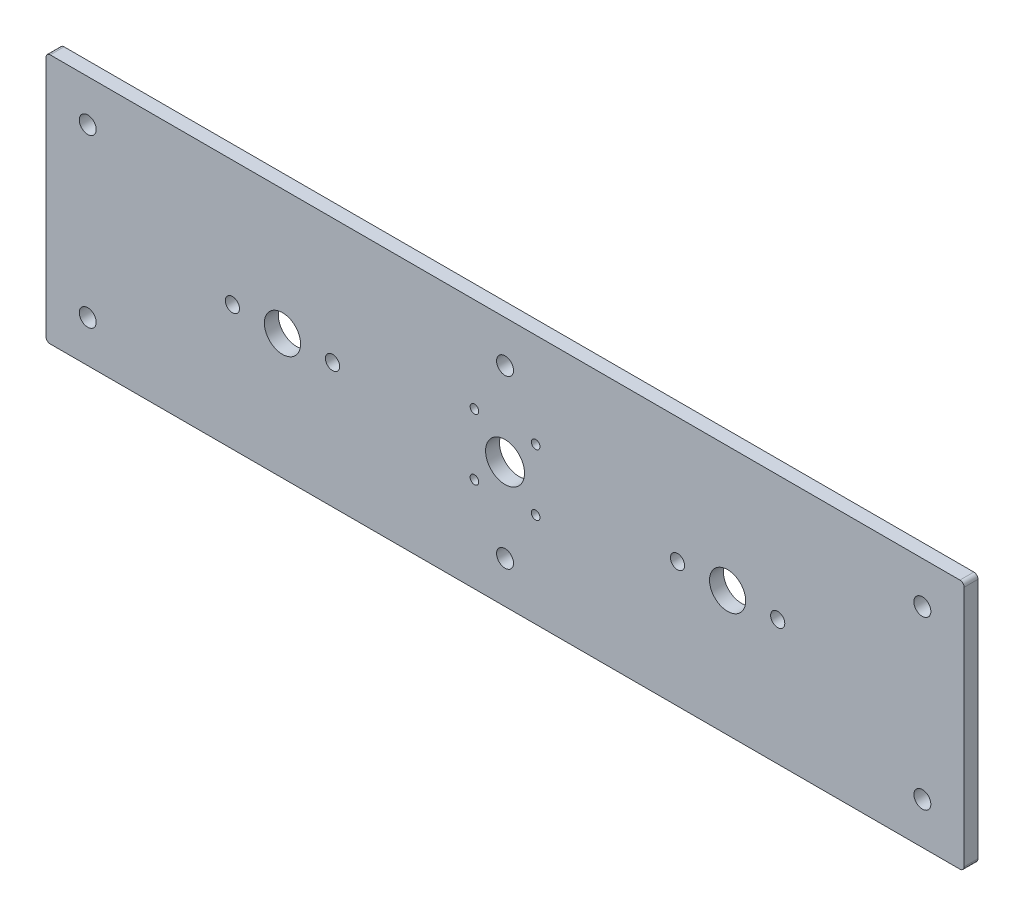
from build123d import *

# Parameters (mm, degrees)
SKETCH1_W           = 330
SKETCH1_H           = 90
BOSS_EXTRUDE1_DEPTH = 2.5
SKETCH2_R           = 3.05
CUT_EXTRUDE1_DEPTH  = 172.099386323
SKETCH3_R           = 6.5
SKETCH3_R_2         = 2.55
CUT_EXTRUDE2_DEPTH  = 172.099386323
SKETCH4_R           = 1.55
SKETCH4_R_2         = 7
CUT_EXTRUDE3_DEPTH  = 172.099386323
FILLET1_R           = 1.5


with BuildPart() as part:
    # Sketch1 → Boss-Extrude1 (new, symmetric)
    with BuildSketch(Plane.XY):
        Rectangle(SKETCH1_W, SKETCH1_H)
    extrude(amount=BOSS_EXTRUDE1_DEPTH, both=True)

    # Sketch2 → Cut-Extrude1 (cut, through all)
    with BuildSketch(Plane.XY.offset(2.5)):
        with Locations((150, 30)):
            Circle(SKETCH2_R)
        with Locations((150, -30)):
            Circle(SKETCH2_R)
        with Locations((0, 30)):
            Circle(SKETCH2_R)
        with Locations((0, -30)):
            Circle(SKETCH2_R)
        with Locations((-150, -30)):
            Circle(SKETCH2_R)
        with Locations((-150, 30)):
            Circle(SKETCH2_R)
    extrude(amount=-CUT_EXTRUDE1_DEPTH, mode=Mode.SUBTRACT)

    # Sketch3 → Cut-Extrude2 (cut, through all)
    with BuildSketch(Plane.XY.offset(2.5)):
        with Locations((-80, 0)):
            Circle(SKETCH3_R)
        with Locations((-62, 0)):
            Circle(SKETCH3_R_2)
        with Locations((-98, 0)):
            Circle(SKETCH3_R_2)
    cut_extrude2 = extrude(amount=-CUT_EXTRUDE2_DEPTH, mode=Mode.SUBTRACT)

    # Mirror1: Cut-Extrude2 across plane
    add(cut_extrude2.mirror(Plane(origin=(0, 0, 0), x_dir=(0, 0, 1), z_dir=(1, 0, 0))), mode=Mode.SUBTRACT)

    # Sketch4 → Cut-Extrude3 (cut, through all)
    with BuildSketch(Plane.XY.offset(2.5)):
        with Locations((11, 11)):
            Circle(SKETCH4_R)
        with Locations((11, -11)):
            Circle(SKETCH4_R)
        with Locations((-11, -11)):
            Circle(SKETCH4_R)
        with Locations((-11, 11)):
            Circle(SKETCH4_R)
        Circle(SKETCH4_R_2)
    extrude(amount=-CUT_EXTRUDE3_DEPTH, mode=Mode.SUBTRACT)

    # Fillet1
    fillet1_edges = [part.edges().sort_by_distance(p)[0] for p in [
        (-165, -45, 0),
        (-165, 45, 0),
        (165, -45, 0),
        (165, 45, 0),
    ]]
    fillet(fillet1_edges, radius=FILLET1_R)


solid = part.part
